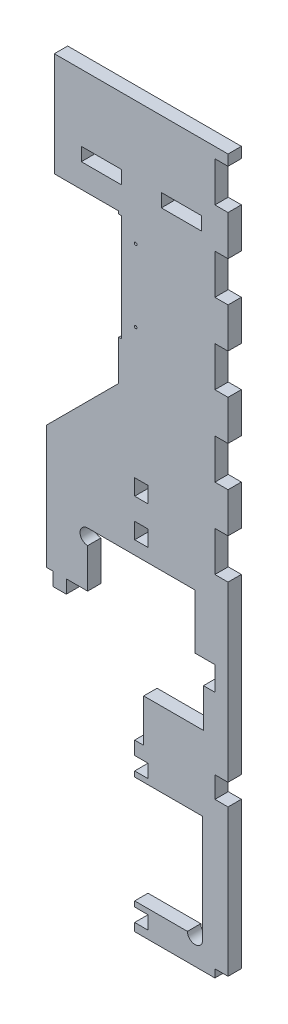
from build123d import *

# Parameters (mm, degrees)
BOSS_EXTRU_1_DEPTH      = 5
ESQUISSE2_R             = 2.8575
ESQUISSE2_R_2           = 0.5
ESQUISSE2_W             = 5
ESQUISSE2_H             = 6
ESQUISSE2_W_2           = 4.274370263
ESQUISSE2_H_2           = 8.980069935
ESQUISSE2_W_3           = 4.92
ESQUISSE2_H_3           = 3
ESQUISSE2_H_4           = 8
ESQUISSE2_H_5           = 15
ESQUISSE2_W_4           = 15
ESQUISSE2_H_6           = 5
ESQUISSE2_W_5           = 1
ESQUISSE2_H_7           = 40
ENL_V_MAT_EXTRU_1_DEPTH = 5
ESQUISSE3_W             = 5
ESQUISSE3_H             = 5
BOSS_EXTRU_2_DEPTH      = 5


with BuildPart() as part:
    # Esquisse1 → Boss.-Extru.1 (new body)
    with BuildSketch(Plane.XY):
        Polygon((65.121094869, 0), (30.122364869, 0), (30.122364869, 3), (35.122364869, 3), (35.122364869, 8), (30.122364869, 8), (30.122364869, 10), (55.617614869, 10), (55.617614869, 50.2), (30.122364869, 50.2), (30.122364869, 52.2), (35.122364869, 52.2), (35.122364869, 57.2), (30.122364869, 57.2), (30.122364869, 62.2), (33.512280837, 62.2), (33.512280837, 78.240708175), (55.911629737, 78.240708175), (55.911629737, 101.750434868), (52.693, 101.750434868), (52.693, 122.246954868), (12.493, 122.246954868), (12.493, 101.750434868), (-2.878905131, 101.750434868), (-2.878905131, 148), (24.121094869, 175), (24.121094869, 231), (0, 231), (0, 270), (65.121094869, 270), align=None)
    extrude(amount=-BOSS_EXTRU_1_DEPTH)

    # Esquisse2 → Enlèv. mat.-Extru.1 (cut)
    with BuildSketch(Plane.XY):
        with Locations((12.493, 119.389454868)):
            Circle(ESQUISSE2_R)
        with Locations((30.493, 223.5)):
            Circle(ESQUISSE2_R_2)
        with Locations((30.493, 196.5)):
            Circle(ESQUISSE2_R_2)
        with Locations((52.760114869, 10)):
            Circle(ESQUISSE2_R)
        with Locations((32.622364869, 144.401636706)):
            Rectangle(ESQUISSE2_W, ESQUISSE2_H)
        with Locations((32.622364869, 130.246954868)):
            Rectangle(ESQUISSE2_W, ESQUISSE2_H)
        with Locations((58.048814869, 97.260399901)):
            Rectangle(ESQUISSE2_W_2, ESQUISSE2_H_2)
        with Locations((62.661094869, 1.5)):
            Rectangle(ESQUISSE2_W_3, ESQUISSE2_H_3)
        with Locations((62.661094869, 62)):
            Rectangle(ESQUISSE2_W_3, ESQUISSE2_H_4)
        with Locations((62.661094869, 168.5)):
            Rectangle(ESQUISSE2_W_3, ESQUISSE2_H_5)
        with Locations((62.661094869, 138.5)):
            Rectangle(ESQUISSE2_W_3, ESQUISSE2_H_5)
        with Locations((62.661094869, 198.5)):
            Rectangle(ESQUISSE2_W_3, ESQUISSE2_H_5)
        with Locations((62.661094869, 228.5)):
            Rectangle(ESQUISSE2_W_3, ESQUISSE2_H_5)
        with Locations((62.661094869, 258.5)):
            Rectangle(ESQUISSE2_W_3, ESQUISSE2_H_5)
        with Locations((47.621094869, 242.5)):
            Rectangle(ESQUISSE2_W_4, ESQUISSE2_H_6)
        with Locations((17.621094869, 242.5)):
            Rectangle(ESQUISSE2_W_4, ESQUISSE2_H_6)
        with Locations((24.621094869, 210)):
            Rectangle(ESQUISSE2_W_5, ESQUISSE2_H_7)
    extrude(amount=-ENL_V_MAT_EXTRU_1_DEPTH, mode=Mode.SUBTRACT)

    # Esquisse3 → Boss.-Extru.2 (add)
    with BuildSketch(Plane.XY):
        with Locations((1.993, 99.250434868)):
            Rectangle(ESQUISSE3_W, ESQUISSE3_H)
    extrude(amount=-BOSS_EXTRU_2_DEPTH)


solid = part.part
